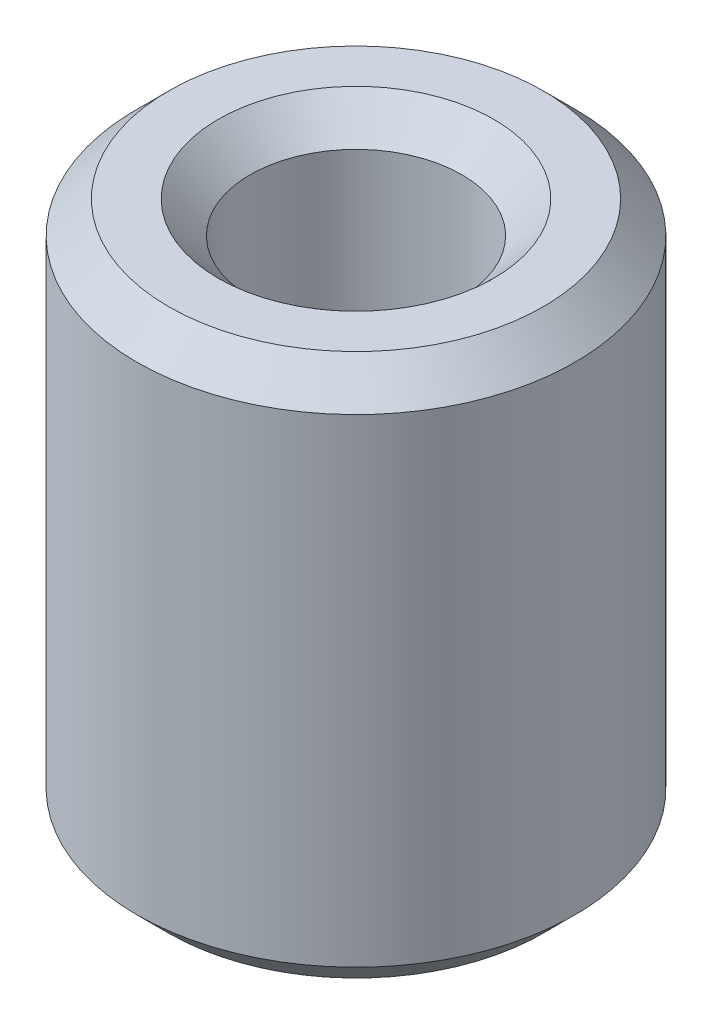
from build123d import *

# Parameters (mm, degrees)
SKETCH1_R           = 5
BOSS_EXTRUDE1_DEPTH = 12.3808774
SKETCH2_R           = 2.414044755
CUT_EXTRUDE1_DEPTH  = 15.257844339
CHAMFER1_SIZE       = 0.729539156


with BuildPart() as part:
    # Sketch1 → Boss-Extrude1 (new body)
    with BuildSketch(Plane(origin=(0, 0, 0), x_dir=(1, 0, 0), z_dir=(0, 1, 0))):
        Circle(SKETCH1_R)
    extrude(amount=BOSS_EXTRUDE1_DEPTH)

    # Sketch2 → Cut-Extrude1 (cut, through all)
    with BuildSketch(Plane(origin=(0, 0, 0), x_dir=(1, 0, 0), z_dir=(0, 1, 0))):
        Circle(SKETCH2_R)
    extrude(amount=CUT_EXTRUDE1_DEPTH, mode=Mode.SUBTRACT)

    # Chamfer1
    chamfer1_edges = [part.edges().sort_by_distance(p)[0] for p in [
        (-2.414044755, 12.3808774, 0),
        (-2.414044755, 0, 0),
        (-5, 0, 0),
        (-5, 12.3808774, 0),
    ]]
    chamfer(chamfer1_edges, length=CHAMFER1_SIZE)


solid = part.part
